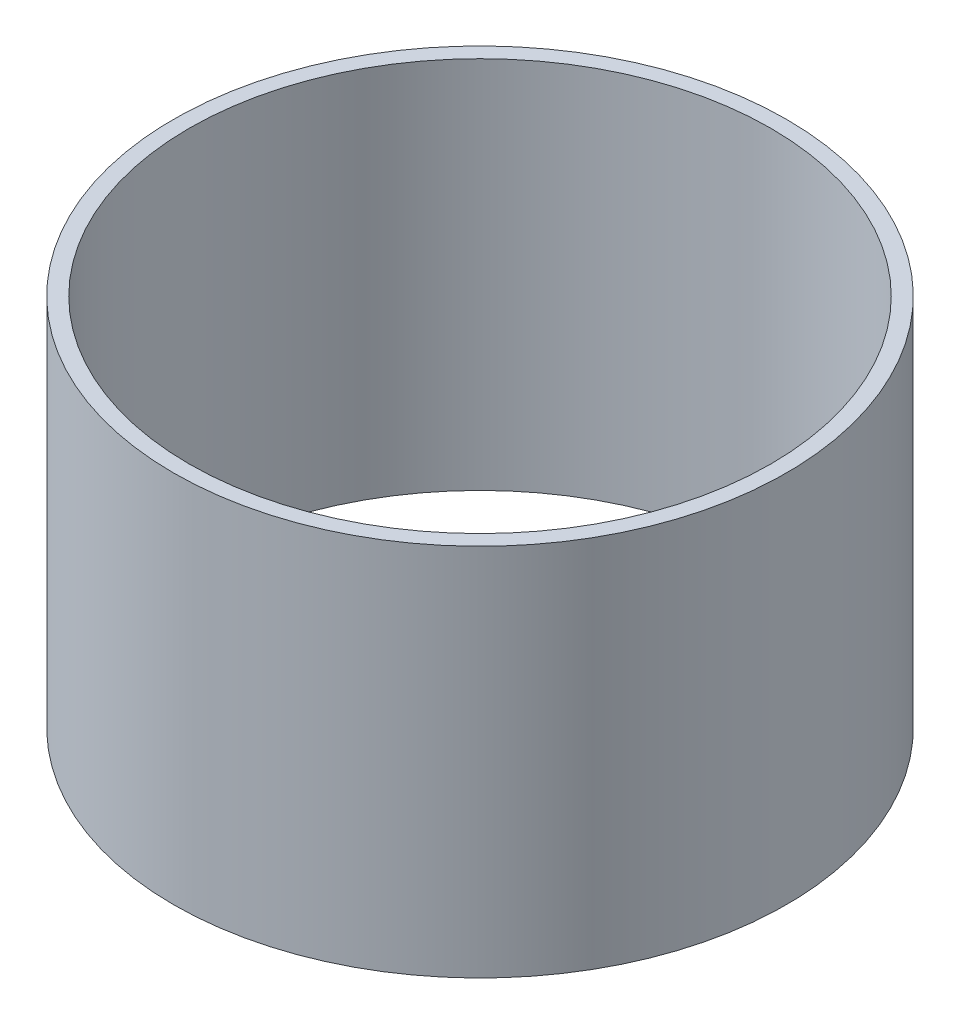
from build123d import *

# Parameters (mm, degrees)
SKETCH1_R           = 93.6625
SKETCH1_R_2         = 88.9
BOSS_EXTRUDE1_DEPTH = 57.15127


with BuildPart() as part:
    # Sketch1 → Boss-Extrude1 (new, symmetric)
    with BuildSketch(Plane(origin=(0, 0, 0), x_dir=(1, 0, 0), z_dir=(0, 1, 0))):
        Circle(SKETCH1_R)
        Circle(SKETCH1_R_2, mode=Mode.SUBTRACT)
    extrude(amount=BOSS_EXTRUDE1_DEPTH, both=True)


solid = part.part
